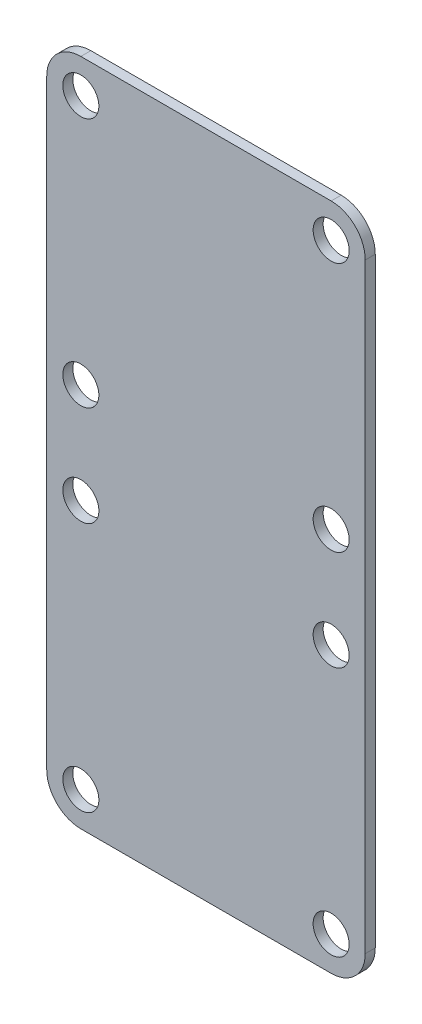
from build123d import *

# Parameters (mm, degrees)
SKETCH1_R           = 3.6
BOSS_EXTRUDE1_DEPTH = 2


with BuildPart() as part:
    # Sketch1 → Boss-Extrude1 (new body)
    with BuildSketch(Plane.XY):
        with BuildLine():
            Line((31.81, 60), (31.81, -60))
            ThreePointArc((31.81, -60), (29.81539718, -64.81539718), (25, -66.81))
            Line((25, -66.81), (-25, -66.81))
            ThreePointArc((-25, -66.81), (-29.81539718, -64.81539718), (-31.81, -60))
            Line((-31.81, -60), (-31.81, 60))
            ThreePointArc((-31.81, 60), (-29.81539718, 64.81539718), (-25, 66.81))
            Line((-25, 66.81), (25, 66.81))
            ThreePointArc((25, 66.81), (29.81539718, 64.81539718), (31.81, 60))
        make_face()
        with Locations((-25, 60)):
            Circle(SKETCH1_R, mode=Mode.SUBTRACT)
        with Locations((25, 60)):
            Circle(SKETCH1_R, mode=Mode.SUBTRACT)
        with Locations((-25, 10)):
            Circle(SKETCH1_R, mode=Mode.SUBTRACT)
        with Locations((25, 10)):
            Circle(SKETCH1_R, mode=Mode.SUBTRACT)
        with Locations((-25, -10)):
            Circle(SKETCH1_R, mode=Mode.SUBTRACT)
        with Locations((25, -10)):
            Circle(SKETCH1_R, mode=Mode.SUBTRACT)
        with Locations((-25, -60)):
            Circle(SKETCH1_R, mode=Mode.SUBTRACT)
        with Locations((25, -60)):
            Circle(SKETCH1_R, mode=Mode.SUBTRACT)
    extrude(amount=BOSS_EXTRUDE1_DEPTH)


solid = part.part
